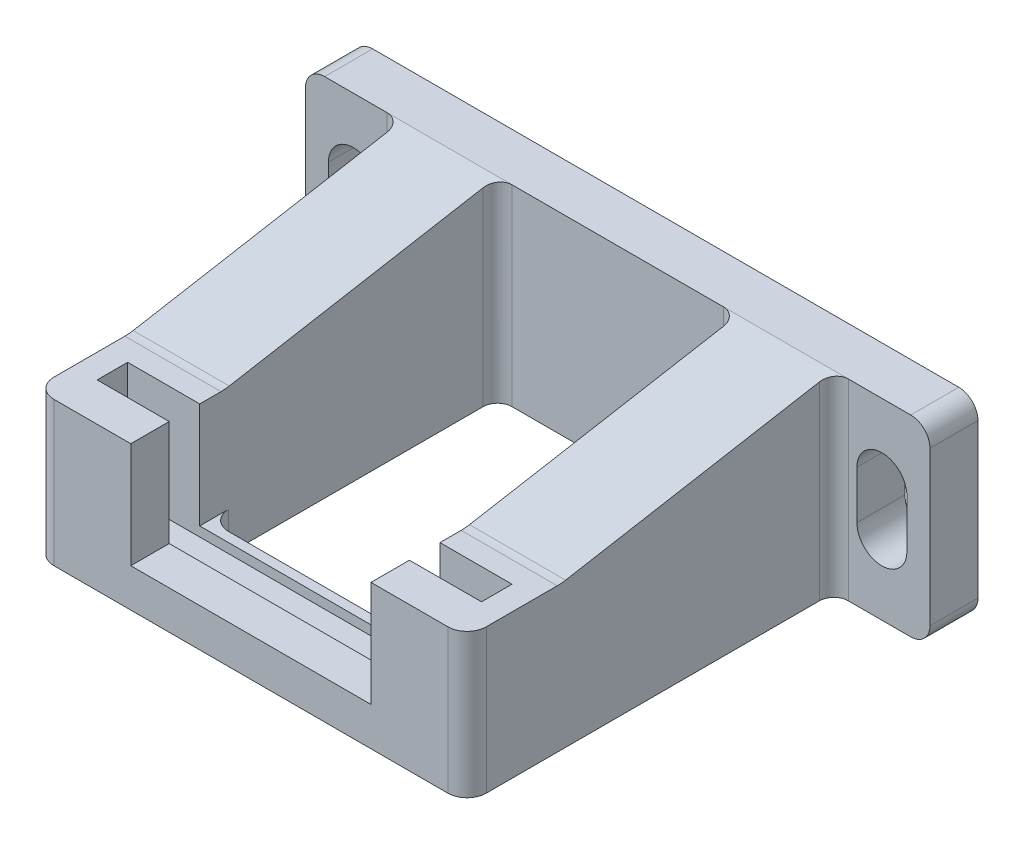
from build123d import *

# Parameters (mm, degrees)
BOSS_EXTRUDE1_DEPTH = 35
CUT_EXTRUDE1_DEPTH  = 25
SKETCH3_W           = 25
SKETCH3_H           = 28.356409098
BOSS_EXTRUDE2_DEPTH = 5
BOSS_EXTRUDE3_DEPTH = 10
SKETCH5_W           = 28.356409098
SKETCH5_H           = 20
BOSS_EXTRUDE4_DEPTH = 10
SKETCH6_W           = 55
SKETCH6_H           = 15
BOSS_EXTRUDE5_DEPTH = 9.818590902
SKETCH7_W           = 28.356409098
SKETCH7_H           = 20
BOSS_EXTRUDE6_DEPTH = 10
SKETCH8_W           = 65
SKETCH8_H           = 20
BOSS_EXTRUDE7_DEPTH = 5
SKETCH9_W           = 10
SKETCH9_H           = 20
CUT_EXTRUDE2_DEPTH  = 28.356409098
SKETCH10_W          = 9.818590902
SKETCH10_H          = 15
CUT_EXTRUDE3_DEPTH  = 10
SKETCH11_W          = 10
SKETCH11_H          = 20
CUT_EXTRUDE4_DEPTH  = 28.356409098
SKETCH12_W          = 15
SKETCH12_H          = 1.643590902
CUT_EXTRUDE5_DEPTH  = 25
SKETCH13_W          = 25
SKETCH13_H          = 20
CUT_EXTRUDE6_DEPTH  = 28.356409098
CUT_EXTRUDE7_REACH  = 64.926
SKETCH14_W          = 25
SKETCH14_H          = 11
SKETCH15_W          = 25
SKETCH15_H          = 3.175
CUT_EXTRUDE8_DEPTH  = 1
CUT_EXTRUDE9_REACH  = 72.854
SKETCH16_W          = 3.175
SKETCH16_H          = 12
CUT_EXTRUDE10_REACH = 72.854
SKETCH17_W          = 12
SKETCH17_H          = 3.175
CUT_EXTRUDE11_REACH = 67.491
SKETCH18_W          = 25
SKETCH18_H          = 11
CUT_EXTRUDE12_DEPTH = 66.491072865
CUT_EXTRUDE13_DEPTH = 63.308351166
FILLET1_R           = 1.5
FILLET2_R           = 2
FILLET3_R           = 5


with BuildPart() as part:
    # Boss-Extrude1: read off the stored shape, not the designer's step
    # Boss-Extrude1 outline → Boss-Extrude1 (new body)
    with BuildSketch(Plane.YZ):
        Polygon((0, 5), (20, 5), (15, 33.356409098), (0, 33.356409098), align=None)
    extrude(amount=BOSS_EXTRUDE1_DEPTH)

    # Sketch2 → Cut-Extrude1 (cut)
    with BuildSketch(Plane.ZY):
        Polygon((33.356409098, 15), (5, 20), (5, 15), align=None)
    extrude(amount=-CUT_EXTRUDE1_DEPTH, mode=Mode.SUBTRACT)

    # Sketch3 → Boss-Extrude2 (add)
    with BuildSketch(Plane(origin=(0, 15, 0), x_dir=(-1, 0, 0), z_dir=(0, 1, 0))):
        with Locations((-12.5, 19.178204549)):
            Rectangle(SKETCH3_W, SKETCH3_H)
    extrude(amount=BOSS_EXTRUDE2_DEPTH)

    # Sketch4 → Boss-Extrude3 (add)
    with BuildSketch(Plane.ZY):
        Polygon((5, 20), (33.356409098, 15), (33.356409098, 0), (5, 0), align=None)
    extrude(amount=BOSS_EXTRUDE3_DEPTH)

    # Sketch5 → Boss-Extrude4 (add)
    with BuildSketch(Plane.ZY.offset(10)):
        with Locations((19.178204549, 10)):
            Rectangle(SKETCH5_W, SKETCH5_H)
    extrude(amount=BOSS_EXTRUDE4_DEPTH)

    # Sketch6 → Boss-Extrude5 (add)
    with BuildSketch(Plane.XY.offset(33.356409098)):
        with Locations((7.5, 7.5)):
            Rectangle(SKETCH6_W, SKETCH6_H)
    extrude(amount=BOSS_EXTRUDE5_DEPTH)

    # Sketch7 → Boss-Extrude6 (add)
    with BuildSketch(Plane(origin=(35, 0, 0), x_dir=(0, 0, -1), z_dir=(1, 0, 0))):
        with Locations((-19.178204549, 10)):
            Rectangle(SKETCH7_W, SKETCH7_H)
    extrude(amount=BOSS_EXTRUDE6_DEPTH)

    # Sketch8 → Boss-Extrude7 (add)
    with BuildSketch(Plane(origin=(0, 0, 5), x_dir=(-1, 0, 0), z_dir=(0, 0, -1))):
        with Locations((-12.5, 10)):
            Rectangle(SKETCH8_W, SKETCH8_H)
    extrude(amount=BOSS_EXTRUDE7_DEPTH)

    # Sketch9 → Cut-Extrude2 (cut)
    with BuildSketch(Plane.XY.offset(33.356409098)):
        with Locations((40, 10)):
            Rectangle(SKETCH9_W, SKETCH9_H)
    extrude(amount=-CUT_EXTRUDE2_DEPTH, mode=Mode.SUBTRACT)

    # Sketch10 → Cut-Extrude3 (cut)
    with BuildSketch(Plane.ZY.offset(20)):
        with Locations((38.265704549, 7.5)):
            Rectangle(SKETCH10_W, SKETCH10_H)
    extrude(amount=-CUT_EXTRUDE3_DEPTH, mode=Mode.SUBTRACT)

    # Sketch11 → Cut-Extrude4 (cut)
    with BuildSketch(Plane.XY.offset(33.356409098)):
        with Locations((-15, 10)):
            Rectangle(SKETCH11_W, SKETCH11_H)
    extrude(amount=-CUT_EXTRUDE4_DEPTH, mode=Mode.SUBTRACT)

    # Sketch12 → Cut-Extrude5 (cut)
    with BuildSketch(Plane(origin=(0, 0, 0), x_dir=(0, -1, 0), z_dir=(-1, 0, 0))):
        with Locations((-7.5, 34.178204549)):
            Rectangle(SKETCH12_W, SKETCH12_H)
    extrude(amount=-CUT_EXTRUDE5_DEPTH, mode=Mode.SUBTRACT)

    # Sketch13 → Cut-Extrude6 (cut)
    with BuildSketch(Plane.XY.offset(33.356409098)):
        with Locations((12.5, 10)):
            Rectangle(SKETCH13_W, SKETCH13_H)
    extrude(amount=-CUT_EXTRUDE6_DEPTH, mode=Mode.SUBTRACT)

    # Sketch14 → Cut-Extrude7 (cut, up to next)
    with BuildSketch(Plane.XY.offset(39.175), mode=Mode.PRIVATE) as cut_extrude7_sk1:
        with Locations((12.5, 9.5)):
            Rectangle(SKETCH14_W, SKETCH14_H)
    cut_extrude7_tool1 = extrude(cut_extrude7_sk1.sketch, amount=-CUT_EXTRUDE7_REACH, mode=Mode.PRIVATE) & part.part
    add(cut_extrude7_tool1.solids().sort_by_distance((12.5, 9.5, 39.175))[0], mode=Mode.SUBTRACT)

    # Sketch15 → Cut-Extrude8 (cut)
    with BuildSketch(Plane(origin=(0, 4, 0), x_dir=(-1, 0, 0), z_dir=(0, 1, 0))):
        with Locations((-12.5, 37.5875)):
            Rectangle(SKETCH15_W, SKETCH15_H)
    extrude(amount=-CUT_EXTRUDE8_DEPTH, mode=Mode.SUBTRACT)

    # Sketch16 → Cut-Extrude9 (cut, up to next)
    with BuildSketch(Plane(origin=(32.5, 0, 0), x_dir=(0, 0, -1), z_dir=(1, 0, 0)), mode=Mode.PRIVATE) as cut_extrude9_sk1:
        with Locations((-37.5875, 9)):
            Rectangle(SKETCH16_W, SKETCH16_H)
    cut_extrude9_tool1 = extrude(cut_extrude9_sk1.sketch, amount=-CUT_EXTRUDE9_REACH, mode=Mode.PRIVATE) & part.part
    add(cut_extrude9_tool1.solids().sort_by_distance((32.5, 9, 37.5875))[0], mode=Mode.SUBTRACT)

    # Sketch17 → Cut-Extrude10 (cut, up to next)
    with BuildSketch(Plane(origin=(-7.5, 0, 0), x_dir=(0, -1, 0), z_dir=(-1, 0, 0)), mode=Mode.PRIVATE) as cut_extrude10_sk1:
        with Locations((-9, 37.5875)):
            Rectangle(SKETCH17_W, SKETCH17_H)
    cut_extrude10_tool1 = extrude(cut_extrude10_sk1.sketch, amount=-CUT_EXTRUDE10_REACH, mode=Mode.PRIVATE) & part.part
    add(cut_extrude10_tool1.solids().sort_by_distance((-7.5, 9, 37.5875))[0], mode=Mode.SUBTRACT)

    # Sketch18 → Cut-Extrude11 (cut, up to next)
    with BuildSketch(Plane.XY.offset(43.175), mode=Mode.PRIVATE) as cut_extrude11_sk1:
        with Locations((12.5, 9.5)):
            Rectangle(SKETCH18_W, SKETCH18_H)
    cut_extrude11_tool1 = extrude(cut_extrude11_sk1.sketch, amount=-CUT_EXTRUDE11_REACH, mode=Mode.PRIVATE) & part.part
    add(cut_extrude11_tool1.solids().sort_by_distance((12.5, 9.5, 43.175))[0], mode=Mode.SUBTRACT)

    # Sketch19 → Cut-Extrude12 (cut, through all)
    with BuildSketch(Plane(origin=(0, 0, 0), x_dir=(-1, 0, 0), z_dir=(0, 0, -1))):
        with BuildLine():
            Line((-37.4, 7.5), (-37.4, 12.5))
            ThreePointArc((-37.4, 12.5), (-40, 15.1), (-42.6, 12.5))
            Line((-42.6, 12.5), (-42.6, 7.5))
            ThreePointArc((-42.6, 7.5), (-40, 4.9), (-37.4, 7.5))
        make_face()
    extrude(amount=-CUT_EXTRUDE12_DEPTH, mode=Mode.SUBTRACT)

    # Sketch20 → Cut-Extrude13 (cut, through all)
    with BuildSketch(Plane.XY.offset(5)):
        with BuildLine():
            Line((-12.4, 7.5), (-12.4, 12.5))
            ThreePointArc((-12.4, 12.5), (-15, 15.1), (-17.6, 12.5))
            Line((-17.6, 12.5), (-17.6, 7.5))
            ThreePointArc((-17.6, 7.5), (-15, 4.9), (-12.4, 7.5))
        make_face()
    extrude(amount=-CUT_EXTRUDE13_DEPTH, mode=Mode.SUBTRACT)

    # Fillet1
    fillet1_edges = [part.edges().sort_by_distance(p)[0] for p in [
        (35, 10, 5),
        (-10, 10, 5),
        (0, 10, 5),
        (25, 10, 5),
    ]]
    fillet(fillet1_edges, radius=FILLET1_R)

    # Fillet2
    fillet2_edges = [part.edges().sort_by_distance(p)[0] for p in [
        (-20, 0, 2.5),
        (0, 2, 35),
        (45, 0, 2.5),
        (45, 20, 2.5),
        (25, 2, 35),
        (-20, 20, 2.5),
        (-10, 7.5, 43.175),
        (35, 7.5, 43.175),
    ]]
    fillet(fillet2_edges, radius=FILLET2_R)

    # Fillet3
    fillet3_edges = [part.edges().sort_by_distance(p)[0] for p in [
        (30, 15, 33.356409098),
        (-5, 15, 33.356409098),
    ]]
    fillet(fillet3_edges, radius=FILLET3_R)


solid = part.part
